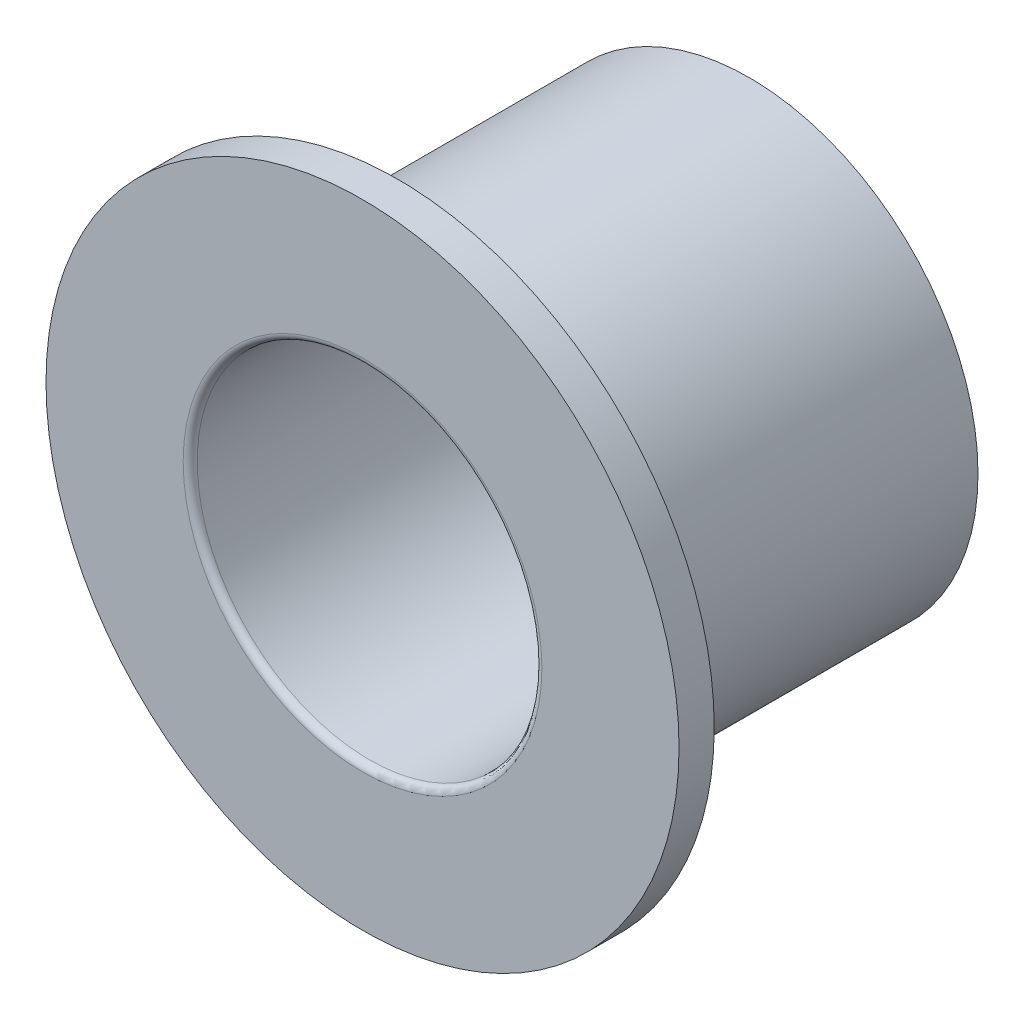
from build123d import *

# Parameters (mm, degrees)
SKETCH1_R               = 1.651
BOSS_EXTRUDE1_DEPTH     = 2.54
SKETCH2_R               = 2.286
BOSS_EXTRUDE2_DEPTH     = 0.254
CUT_EXTRUDE3_DEPTH      = 5.272941376
CUT_EXTRUDE3_DEPTH_BACK = 5.272941376
SKETCH3_R               = 1.2446
FILLET3_R               = 0.0508


with BuildPart() as part:
    # Sketch1 → Boss-Extrude1 (new body)
    with BuildSketch(Plane.XY):
        Circle(SKETCH1_R)
    extrude(amount=BOSS_EXTRUDE1_DEPTH)

    # Sketch2 → Boss-Extrude2 (add)
    with BuildSketch(Plane.XY.offset(2.54)):
        Circle(SKETCH2_R)
    extrude(amount=BOSS_EXTRUDE2_DEPTH)

    # Sketch3 → Cut-Extrude3 (cut, two sides: drawn at the far end of the back side and taken through both)
    with BuildSketch(Plane(origin=(0, 0, 0), x_dir=(-1, 0, 0), z_dir=(0, 0, -1)).offset(-CUT_EXTRUDE3_DEPTH_BACK)):
        Circle(SKETCH3_R)
    extrude(amount=CUT_EXTRUDE3_DEPTH + CUT_EXTRUDE3_DEPTH_BACK, mode=Mode.SUBTRACT)

    # Fillet3
    fillet3_edges = [part.edges().sort_by_distance(p)[0] for p in [
        (1.2446, 0, 2.794),
    ]]
    fillet(fillet3_edges, radius=FILLET3_R)


solid = part.part
